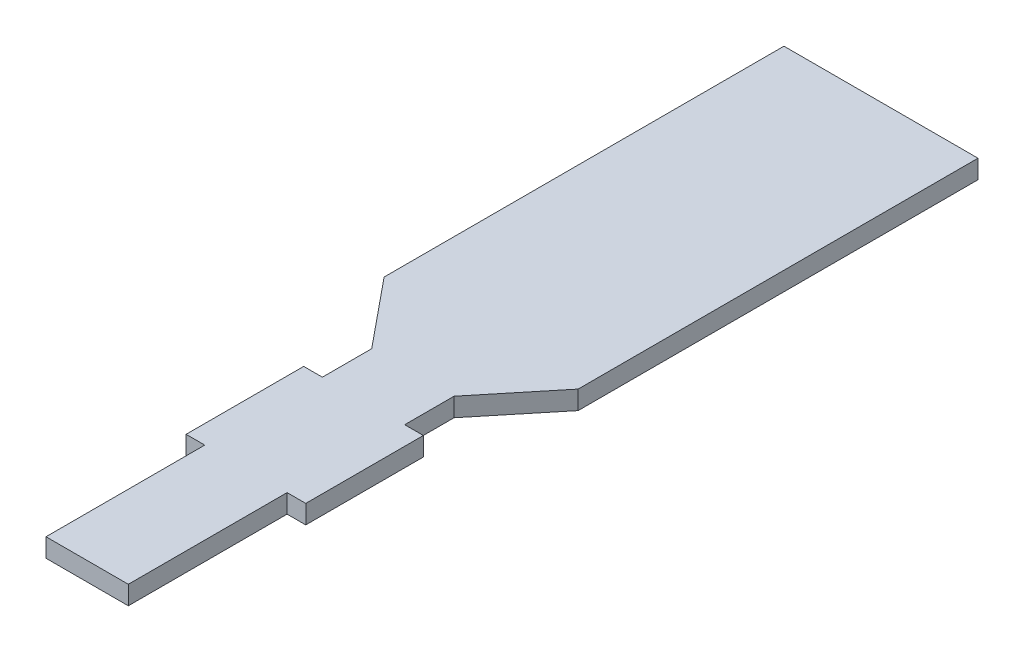
from build123d import *

# Parameters (mm, degrees)
BOSS_EXTRUDE1_DEPTH = 3.175


with BuildPart() as part:
    # Sketch1 → Boss-Extrude1 (new body)
    with BuildSketch(Plane(origin=(0, 0, 0), x_dir=(1, 0, 0), z_dir=(0, 1, 0))):
        Polygon((-16.5, 0), (16.5, 0), (16.5, -68), (7, -79.608186766), (7, -88), (10.175, -88), (10.175, -108), (7, -108), (7, -135), (-7, -135), (-7, -108), (-10.175, -108), (-10.175, -88), (-7, -88), (-7, -79.608186766), (-16.5, -68), align=None)
    extrude(amount=BOSS_EXTRUDE1_DEPTH)


solid = part.part
